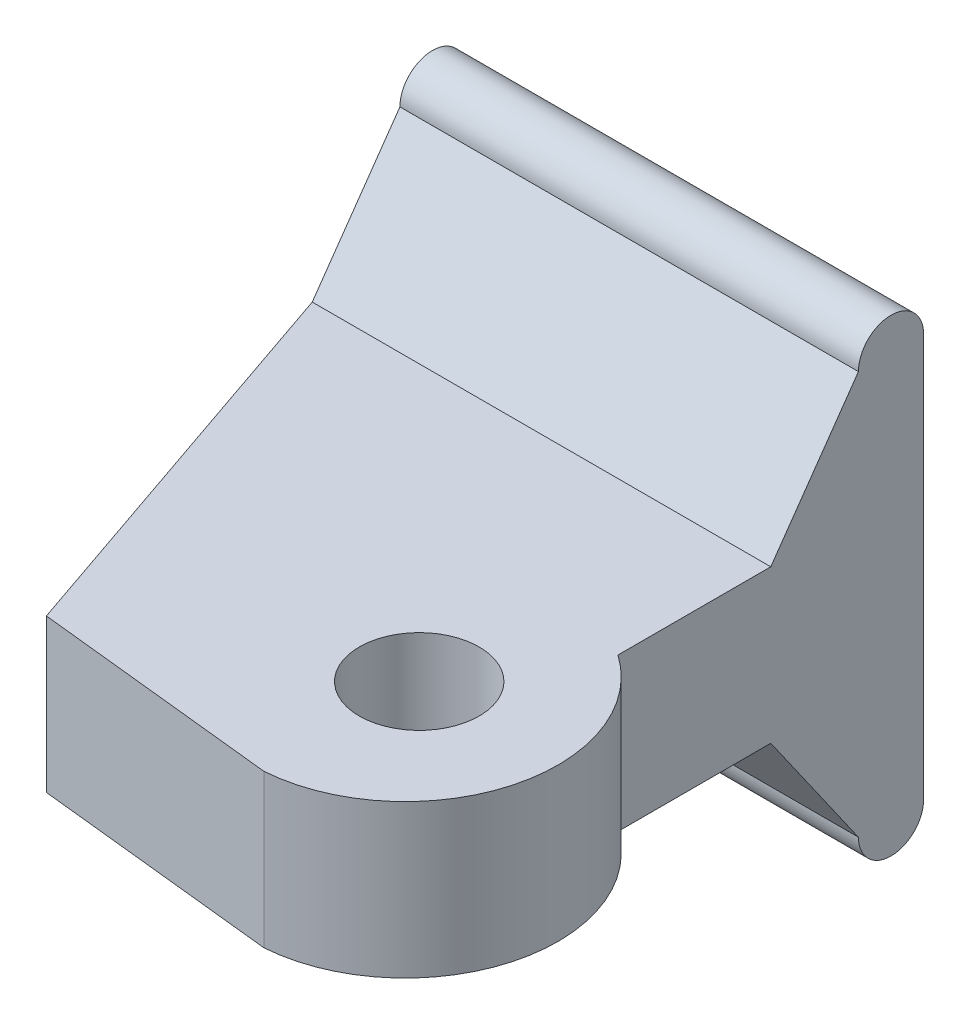
from build123d import *

# Parameters (mm, degrees)
SKETCH1_R               = 2.4892
BOSS_EXTRUDE1_DEPTH     = 6.35
BOSS_EXTRUDE2_START     = -6.35
BOSS_EXTRUDE2_DEPTH     = 19.05
BOSS_EXTRUDE2_START_2   = -6.555460136
BOSS_EXTRUDE2_2_DEPTH   = 19.460920272
BOSS_EXTRUDE2_START_3   = -10
BOSS_EXTRUDE2_3_DEPTH   = 3.65
CUT_EXTRUDE1_DEPTH      = 27.910448217
CUT_EXTRUDE1_DEPTH_BACK = 27.910448217
SKETCH3_W               = 2.179354936
SKETCH3_H               = 6.35


with BuildPart() as part:
    # Sketch1 → Boss-Extrude1 (new body)
    with BuildSketch(Plane(origin=(0, 0, 0), x_dir=(1, 0, 0), z_dir=(0, 1, 0))):
        with BuildLine():
            Line((9.525, -17.889269346), (-0.578271622, -16.817120786))
            Line((-0.578271622, -16.817120786), (-6.35, 0))
            Line((-6.35, 0), (12.7, 0))
            Line((12.7, 0), (12.7, -6.35))
            ThreePointArc((12.7, -6.35), (15.186560179, -13.240601753), (9.525, -17.889269346))
        make_face()
        with Locations(Location((9.525, -11.43, 0), (0, 0, 270))):
            Circle(SKETCH1_R, mode=Mode.SUBTRACT)
    extrude(amount=BOSS_EXTRUDE1_DEPTH)

    # Boss-Extrude2: read off the stored shape, not the designer's step
    # Boss-Extrude2 outline → Boss-Extrude2 (add)
    with BuildSketch(Plane.YZ.offset(BOSS_EXTRUDE2_START)):
        with BuildLine():
            ThreePointArc((11.551615481, -6.35), (12.905510296, -4.996105185), (11.551615481, -3.642210371))
            Line((11.551615481, -3.642210371), (6.35, 0))
            Line((6.35, 0), (0, 0))
            Line((0, 0), (-5.201615481, -3.642210371))
            ThreePointArc((-5.201615481, -3.642210371), (-6.555510296, -4.996105185), (-5.201615481, -6.35))
            Line((-5.201615481, -6.35), (11.551615481, -6.35))
        make_face()
    extrude(amount=BOSS_EXTRUDE2_DEPTH)

    # Boss-Extrude2 2 outline → Boss-Extrude2 2 (add)
    with BuildSketch(Plane(origin=(0, 0, 0), x_dir=(1, 0, 0), z_dir=(0, 1, 0)).offset(BOSS_EXTRUDE2_START_2)):
        Polygon((-8.529354936, 6.35), (-6.35, 0), (-6.35, 6.35), align=None)
    extrude(amount=BOSS_EXTRUDE2_2_DEPTH)

    # Boss-Extrude2 3 outline → Boss-Extrude2 3 (cut)
    with BuildSketch(Plane.YZ.offset(BOSS_EXTRUDE2_START_3)):
        with BuildLine():
            Line((12.905460136, 0), (6.35, 0))
            Line((6.35, 0), (11.551615481, -3.642210371))
            ThreePointArc((11.551615481, -3.642210371), (12.504834401, -4.034645431), (12.905460136, -4.984450993))
            Line((12.905460136, -4.984450993), (12.905460136, 0))
        make_face()
        with BuildLine():
            ThreePointArc((12.905460136, -5.007759378), (12.504834401, -5.95756494), (11.551615481, -6.35))
            Line((11.551615481, -6.35), (12.905460136, -6.35))
            Line((12.905460136, -6.35), (12.905460136, -5.007759378))
        make_face()
        with BuildLine():
            Line((0, 0), (-6.555460136, 0))
            Line((-6.555460136, 0), (-6.555460136, -4.984450993))
            ThreePointArc((-6.555460136, -4.984450993), (-6.154834401, -4.034645431), (-5.201615481, -3.642210371))
            Line((-5.201615481, -3.642210371), (0, 0))
        make_face()
        with BuildLine():
            ThreePointArc((-5.201615481, -6.35), (-6.154834401, -5.95756494), (-6.555460136, -5.007759378))
            Line((-6.555460136, -5.007759378), (-6.555460136, -6.35))
            Line((-6.555460136, -6.35), (-5.201615481, -6.35))
        make_face()
    extrude(amount=BOSS_EXTRUDE2_3_DEPTH, mode=Mode.SUBTRACT)

    # Sketch3 → Cut-Extrude1 (cut, two sides: drawn at the far end of the back side and taken through both)
    with BuildSketch(Plane.XZ.offset(-CUT_EXTRUDE1_DEPTH_BACK)):
        with Locations((-7.439677468, -3.175)):
            Rectangle(SKETCH3_W, SKETCH3_H)
    extrude(amount=CUT_EXTRUDE1_DEPTH + CUT_EXTRUDE1_DEPTH_BACK, mode=Mode.SUBTRACT)


solid = part.part
